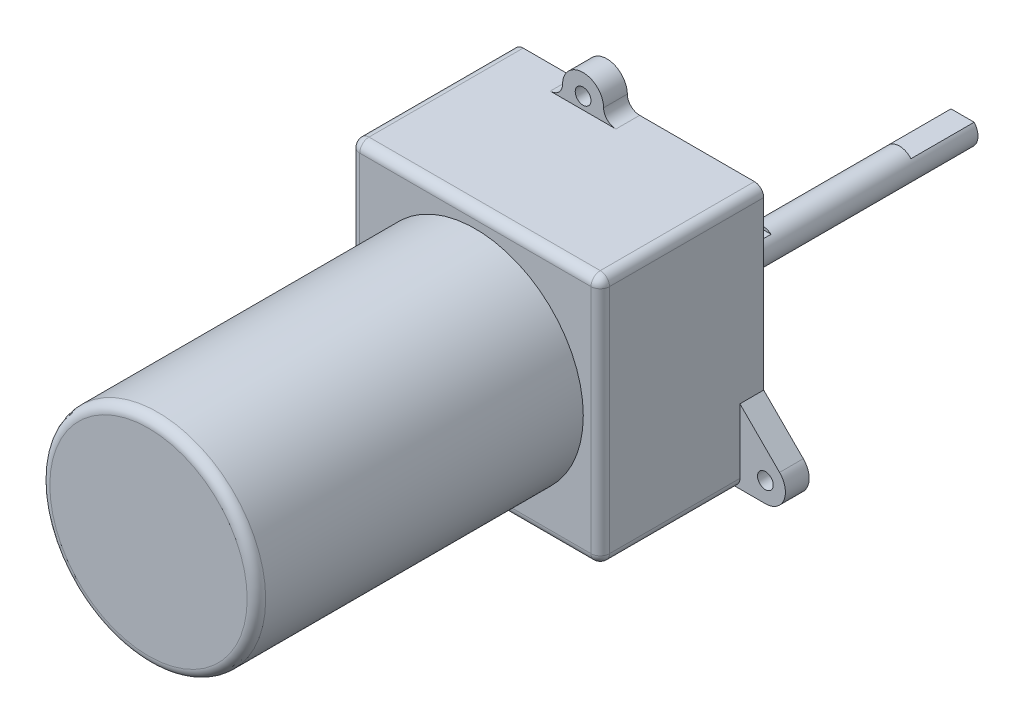
from build123d import *

# Parameters (mm, degrees)
SKETCH1_W           = 81
SKETCH1_H           = 81
BOSS_EXTRUDE1_DEPTH = 53
SKETCH2_R           = 35
BOSS_EXTRUDE2_DEPTH = 106
SKETCH3_R           = 5
BOSS_EXTRUDE3_DEPTH = 105
SKETCH4_R           = 2.55
BOSS_EXTRUDE4_DEPTH = 7.7
FILLET1_R           = 4
FILLET2_R           = 3
CUT_EXTRUDE1_START  = -84.5
SKETCH5_W           = 18.690524158
SKETCH5_H           = 8.031084599
CUT_EXTRUDE1_DEPTH  = 30
CUT_EXTRUDE2_START  = -32.7
CUT_EXTRUDE2_DEPTH  = 7.2


with BuildPart() as part:
    # Sketch1 → Boss-Extrude1 (new body)
    with BuildSketch(Plane.XY):
        with Locations((0, 15.5)):
            Rectangle(SKETCH1_W, SKETCH1_H)
    extrude(amount=BOSS_EXTRUDE1_DEPTH)

    # Sketch2 → Boss-Extrude2 (add)
    with BuildSketch(Plane.XY.offset(53)):
        with Locations((0, 15.5)):
            Circle(SKETCH2_R)
    extrude(amount=BOSS_EXTRUDE2_DEPTH)

    # Sketch3 → Boss-Extrude3 (add)
    with BuildSketch(Plane.XY):
        Circle(SKETCH3_R)
    extrude(amount=-BOSS_EXTRUDE3_DEPTH)

    # Sketch4 → Boss-Extrude4 (add)
    with BuildSketch(Plane.XY):
        with BuildLine():
            Line((-48.75, -25), (48.75, -25))
            ThreePointArc((48.75, -25), (54.755216961, -20.98744231), (53.346194078, -13.903805922))
            Line((53.346194078, -13.903805922), (40.5, -1.057611845))
            Line((40.5, -1.057611845), (40.5, 56))
            Line((40.5, 56), (-3.718974359, 56))
            Line((-3.718974359, 56), (-3.718974359, 59.910374765))
            ThreePointArc((-3.718974359, 59.910374765), (-10.368974359, 66.560374765), (-17.018974359, 59.910374765))
            Line((-17.018974359, 59.910374765), (-17.018974359, 56))
            Line((-17.018974359, 56), (-40.5, 56))
            Line((-40.5, 56), (-40.5, -1.057611845))
            Line((-40.5, -1.057611845), (-53.346194078, -13.903805922))
            ThreePointArc((-53.346194078, -13.903805922), (-54.755216961, -20.98744231), (-48.75, -25))
        make_face()
        with Locations(Location((-48.75, -18.5, 0), (0, 0, 180))):
            Circle(SKETCH4_R, mode=Mode.SUBTRACT)
        with Locations(Location((48.75, -18.5, 0), (0, 0, 180))):
            Circle(SKETCH4_R, mode=Mode.SUBTRACT)
        with Locations(Location((-10.368974359, 59.910374765, 0), (0, 0, 180))):
            Circle(SKETCH4_R, mode=Mode.SUBTRACT)
    extrude(amount=BOSS_EXTRUDE4_DEPTH)

    # Fillet1
    # the kernel refuses this fillet: 4 mm, written as the material it adds along each edge
    with BuildSketch(Plane(origin=(-17.018974359, 56, 0), x_dir=(-1, 0, 0), z_dir=(0, 0, 1))) as fillet1_piece_1:
        with BuildLine():
            CenterArc((3.999622872, -4), FILLET1_R, 90, 89.517820814)
            Line((-0.000235484, -3.96633794), (-0.400221319, -3.962971734))
            ThreePointArc((-0.400221319, -3.962971734), (-0.4, -3.910374765), (-0.4, 0))
            Line((-0.4, 0), (0, 0.4))
            Line((0, 0.4), (3.999622872, 0.4))
            Line((3.999622872, 0.4), (3.999622872, 0))
        make_face()
    extrude(amount=7.7)
    with BuildSketch(Plane(origin=(-3.718974359, 56, 0), x_dir=(1, 0, 0), z_dir=(0, 0, 1))) as fillet1_piece_2:
        with BuildLine():
            CenterArc((3.999622872, 4), FILLET1_R, 180.482179186, 89.517820814)
            Line((-0.000235484, 3.96633794), (-0.400221319, 3.962971734))
            ThreePointArc((-0.400221319, 3.962971734), (-0.4, 3.910374765), (-0.4, 0))
            Line((-0.4, 0), (0, -0.4))
            Line((0, -0.4), (3.999622872, -0.4))
            Line((3.999622872, -0.4), (3.999622872, 0))
        make_face()
    extrude(amount=7.7)

    # Fillet2
    fillet2_edges = [part.edges().sort_by_distance(p)[0] for p in [
        (40.5, 15.5, 53),
        (-35, 15.5, 159),
        (0, 56, 53),
        (-40.5, 15.5, 53),
        (-40.5, 56, 26.5),
        (40.5, 56, 26.5),
        (40.5, -25, 30.35),
        (-40.5, -25, 30.35),
        (0, -25, 53),
    ]]
    fillet(fillet2_edges, radius=FILLET2_R)

    # Sketch5 → Cut-Extrude1 (cut)
    with BuildSketch(Plane.XY.offset(CUT_EXTRUDE1_START)):
        with Locations((0.303510312, 7.3155423)):
            Rectangle(SKETCH5_W, SKETCH5_H)
    extrude(amount=-CUT_EXTRUDE1_DEPTH, mode=Mode.SUBTRACT)

    # Sketch6 → Cut-Extrude2 (cut)
    with BuildSketch(Plane.XY.offset(CUT_EXTRUDE2_START)):
        Polygon((8.240833127, 7.650995437), (8.240833127, 4), (-4, 4), (-4, -6.044194101), (-7.393498293, -6.044194101), (-7.393498293, 7.650995437), align=None)
    extrude(amount=-CUT_EXTRUDE2_DEPTH, mode=Mode.SUBTRACT)


solid = part.part
